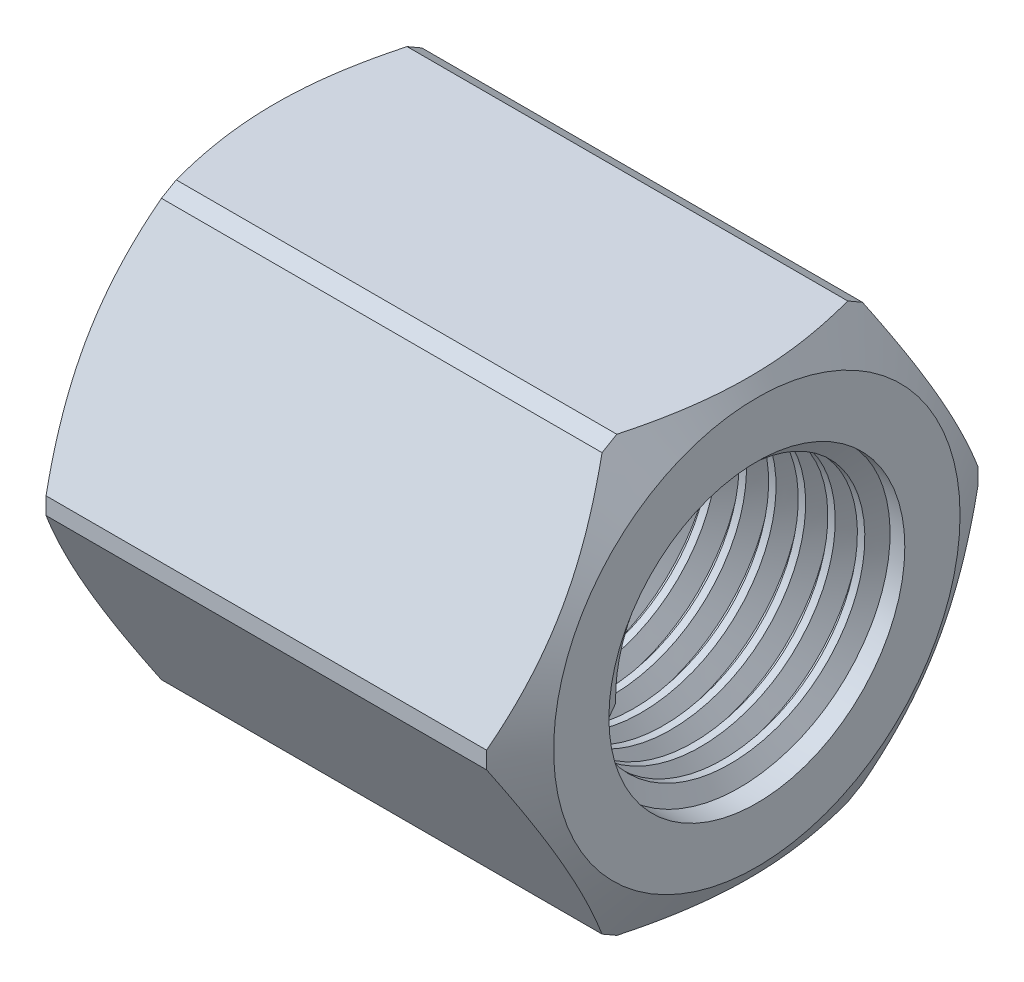
from build123d import *
from build123d.topology import SkipClean

# Parameters (mm, degrees)
SKETCH_1_R          = 3.5
EXTRUDE_1_DEPTH     = 25
SKETCH_9_R          = 7.5
CUT_EXTRUDE_2_DEPTH = 20
THREAD_1_PITCH      = 1.5


with BuildPart() as part:
    # Эскиз1 → Бобышка-Вытянуть1 (new body)
    with BuildSketch(Plane(origin=(0, 0, 0), x_dir=(0, 0, -1), z_dir=(1, 0, 0))):
        Polygon((12.451705922, 0.433012702), (6.600852961, 10.566987298), (5.850852961, 11), (-5.850852961, 11), (-6.600852961, 10.566987298), (-12.451705922, 0.433012702), (-12.451705922, -0.433012702), (-6.600852961, -10.566987298), (-5.850852961, -11), (5.850852961, -11), (6.600852961, -10.566987298), (12.451705922, -0.433012702), align=None)
        Circle(SKETCH_1_R, mode=Mode.SUBTRACT)
    extrude(amount=EXTRUDE_1_DEPTH)

    # Эскиз9 → Вырез-Вытянуть2 (cut)
    with BuildSketch(Plane(origin=(25, 0, 0), x_dir=(0, 0, -1), z_dir=(1, 0, 0))):
        Circle(SKETCH_9_R)
    extrude(amount=-CUT_EXTRUDE_2_DEPTH, mode=Mode.SUBTRACT)

    # Резьба1: the profile of Профиль резьбы2 profile screwed along a right-hand helix of 13.333333 turns, 8 arcs to a turn; built about Z, then put on its axis
    with SkipClean():  # the faces are left unmerged after this step: merging them gives an invalid solid
        thread_1_z = Axis((0, 0, 0), (0, 0, 1))
        thread_1_corners = [(7.5003, 0, -0.000173205), (7.5003, 0, 1.312673201), (6.688101188, 0, 0.843749998), (6.688101188, 0, 0.468749998)]
        with BuildLine(mode=Mode.PRIVATE) as thread_1_profile:
            Line(thread_1_corners[0], thread_1_corners[1])
            Line(thread_1_corners[1], thread_1_corners[2])
            Line(thread_1_corners[2], thread_1_corners[3])
            Line(thread_1_corners[3], thread_1_corners[0])
        thread_1_cap = Face(thread_1_profile.wire())
        thread_1_turn_angles = [0, 22.5, 45, 67.5, 90, 112.5, 135, 157.5, 180, 202.5, 225, 247.5, 270, 292.5, 315, 337.5, 360]
        thread_1_turn_weights = [1, 0.9238795325112867, 1, 0.9238795325112867, 1, 0.9238795325112867, 1, 0.9238795325112867, 1, 0.9238795325112867, 1, 0.9238795325112867, 1, 0.9238795325112867, 1, 0.9238795325112867, 1]
        thread_1_turn_rails = [Edge.make_bspline([Vector(p[0], p[1], 0).rotate(thread_1_z, thread_1_turn_angles[k]) / thread_1_turn_weights[k] + Vector(0, 0, p[2] + THREAD_1_PITCH * thread_1_turn_angles[k] / 360) for k in range(17)], [0, 0, 0, 1, 1, 2, 2, 3, 3, 4, 4, 5, 5, 6, 6, 7, 7, 8, 8, 8], 2, thread_1_turn_weights) for p in thread_1_corners]
        thread_1_turn_sides = [Face.make_surface_from_curves(thread_1_turn_rails[p[0]], thread_1_turn_rails[p[1]]) for p in [(0, 1), (1, 2), (2, 3), (3, 0)]]
        thread_1_last_angles = [4680, 4702.5, 4725, 4747.5, 4770, 4785, 4800]
        thread_1_last_weights = [1, 0.9238795325112867, 1, 0.9238795325112867, 1, 0.9659258262890703, 1]
        thread_1_last_rails = [Edge.make_bspline([Vector(p[0], p[1], 0).rotate(thread_1_z, thread_1_last_angles[k]) / thread_1_last_weights[k] + Vector(0, 0, p[2] + THREAD_1_PITCH * thread_1_last_angles[k] / 360) for k in range(7)], [0, 0, 0, 1, 1, 2, 2, 3, 3, 3], 2, thread_1_last_weights) for p in thread_1_corners]
        thread_1_last_sides = [Face.make_surface_from_curves(thread_1_last_rails[p[0]], thread_1_last_rails[p[1]]) for p in [(0, 1), (1, 2), (2, 3), (3, 0)]]
        thread_1 = Plane(origin=(25, 0, 0), x_dir=(0, 0, 1), z_dir=(-1, 0, 0)) * Solid(Shell([*[p.moved(Location((0, 0, THREAD_1_PITCH * i))) for i in range(13) for p in thread_1_turn_sides], *thread_1_last_sides, thread_1_cap, thread_1_cap.rotate(thread_1_z, 4800).moved(Location((0, 0, THREAD_1_PITCH * 4800 / 360)))]))
        add(thread_1)

    # Вырез-По траектории1: sweep along a path in Эскиз14
    with BuildLine(Plane.ZY) as sweep_1_path:
        CenterArc((0, 0), 10.5, 0, 360)
    # Эскиз15 → Вырез-По траектории1 (sweep, cut)
    with BuildSketch(Plane(origin=(0, 0, 0), x_dir=(1, 0, 0), z_dir=(0, 1, 0))):
        Polygon((0, 10), (0, 14), (2.309401077, 14), align=None)
        Polygon((25.255952947, 14), (25.255952947, 9.856921768), (22.863945614, 14), align=None)
    sweep(path=sweep_1_path.line, mode=Mode.SUBTRACT)


solid = part.part
